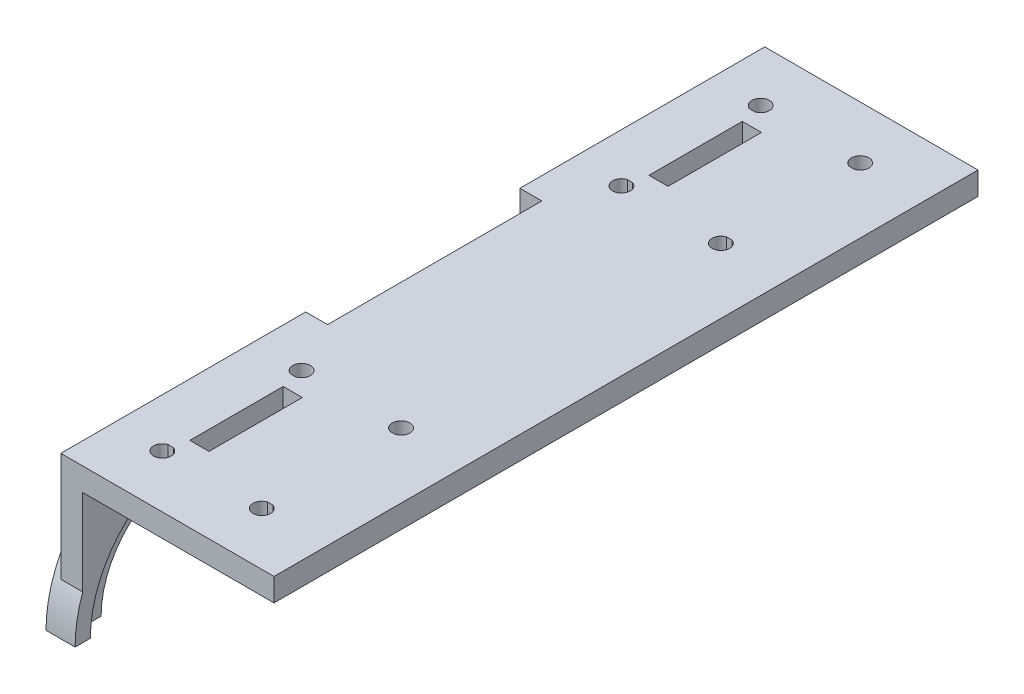
from build123d import *
from build123d.topology import SkipClean

# Parameters (mm, degrees)
SKETCH1_W           = 25
SKETCH1_H           = 46
SKETCH1_W_2         = 2.5
SKETCH1_H_2         = 12.2
BOSS_EXTRUDE1_DEPTH = 3
R_VOLUTION1_START   = -5.80446125
R_VOLUTION1_DEPTH   = 2
R_VOLUTION1_START_2 = -3.80446125
R_VOLUTION1_2_DEPTH = 1.8
BOSS_EXTRUDE3_START = -4.868108072
BOSS_EXTRUDE3_DEPTH = 2.863646822
SKETCH1_11_R        = 3
SKETCH1_11_R_2      = 2
BOSS_EXTRUDE5_DEPTH = 3
CUT_EXTRUDE1_DEPTH  = 46.512082642


# Read off the part's stored shape, not the designer's step: Révolution1, Boss-Extrude3
with BuildPart() as part:
    # Sketch1 → Boss-Extrude1 (new body)
    with BuildSketch(Plane(origin=(0, 0, 0), x_dir=(1, 0, 0), z_dir=(0, 1, 0))):
        with Locations((10.49553875, 12.405576735)):
            Rectangle(SKETCH1_W, SKETCH1_H)
        with Locations((3.34553875, 5.405576735)):
            Rectangle(SKETCH1_W_2, SKETCH1_H_2, mode=Mode.SUBTRACT)
    boss_extrude1 = extrude(amount=BOSS_EXTRUDE1_DEPTH)



with BuildPart() as body_2:
    # Révolution1 outline → Révolution1 (new body)
    with BuildSketch(Plane.YZ.offset(R_VOLUTION1_START)):
        with BuildLine():
            ThreePointArc((-17, 6.394423265), (-5.2, -5.405576735), (-17, -17.205576735))
            Line((-17, -17.205576735), (-17, -22.405576735))
            ThreePointArc((-17, -22.405576735), (0, -5.405576735), (-17, 11.594423265))
            Line((-17, 11.594423265), (-17, 6.394423265))
        make_face()
    r_volution1 = extrude(amount=R_VOLUTION1_DEPTH)


with BuildPart() as part_1:
    add(part.part)

    add(body_2.part)  # R_volution1 2 merges body 2
    # R_volution1 2 outline → R_volution1 2 (add)
    with BuildSketch(Plane.YZ.offset(R_VOLUTION1_START_2)):
        with BuildLine():
            ThreePointArc((-17, 9.594423265), (-2, -5.405576735), (-17, -20.405576735))
            Line((-17, -20.405576735), (-17, -22.405576735))
            ThreePointArc((-17, -22.405576735), (0, -5.405576735), (-17, 11.594423265))
            Line((-17, 11.594423265), (-17, 9.594423265))
        make_face()
    r_volution1_2 = extrude(amount=R_VOLUTION1_2_DEPTH)

    # Boss-Extrude3 outline → Boss-Extrude3 (add)
    with BuildSketch(Plane.YZ.offset(BOSS_EXTRUDE3_START)):
        with BuildLine():
            Line((3, 10.594423265), (-11.255437353, 10.594423265))
            ThreePointArc((-11.255437353, 10.594423265), (0, -5.405576735), (-11.255437353, -21.405576735))
            Line((-11.255437353, -21.405576735), (3, -21.405576735))
            Line((3, -21.405576735), (3, 10.594423265))
        make_face()
    boss_extrude3 = extrude(amount=BOSS_EXTRUDE3_DEPTH)

    # Sketch1<11> → Boss-Extrude5 (add)
    # profile 1 of 14: a face of its own
    with SkipClean():  # the faces are left unmerged after this step: merging them gives an invalid solid
        with BuildSketch(Plane(origin=(0, 0, 0), x_dir=(1, 0, 0), z_dir=(0, 1, 0))):
            with Locations(Location((14.49553875, -3.694423265, 0), (0, 0, 270))):
                Circle(SKETCH1_11_R)
            with Locations(Location((14.49553875, -3.694423265, 0), (0, 0, 270))):
                Circle(SKETCH1_11_R_2, mode=Mode.SUBTRACT)
        # profile 2 of 14: a face of its own
        with BuildSketch(Plane(origin=(0, 0, 0), x_dir=(1, 0, 0), z_dir=(0, 1, 0))):
            with Locations(Location((14.49553875, 14.505576735, 0), (0, 0, 270))):
                Circle(SKETCH1_11_R)
            with Locations(Location((14.49553875, 14.505576735, 0), (0, 0, 270))):
                Circle(SKETCH1_11_R_2, mode=Mode.SUBTRACT)
        # profile 3 of 14: a face of its own
        with BuildSketch(Plane(origin=(0, 0, 0), x_dir=(1, 0, 0), z_dir=(0, 1, 0))):
            with BuildLine():
                ThreePointArc((17.49553875, 14.505576735), (13.935704597, 17.452878166), (11.704481603, 13.405576735))
                Line((11.704481603, 13.405576735), (12.825209441, 13.405576735))
                ThreePointArc((12.825209441, 13.405576735), (13.921369184, 16.421387088), (16.49553875, 14.505576735))
                ThreePointArc((16.49553875, 14.505576735), (16.411349103, 13.931407169), (16.165868059, 13.405576735))
                Line((16.165868059, 13.405576735), (17.286595897, 13.405576735))
                ThreePointArc((17.286595897, 13.405576735), (17.44284018, 13.945742582), (17.49553875, 14.505576735))
            make_face()
        # profile 4 of 14: a face of its own
        with BuildSketch(Plane(origin=(0, 0, 0), x_dir=(1, 0, 0), z_dir=(0, 1, 0))):
            with BuildLine():
                Line((12.825209441, 13.405576735), (11.704481603, 13.405576735))
                ThreePointArc((11.704481603, 13.405576735), (14.49553875, 11.505576735), (17.286595897, 13.405576735))
                Line((17.286595897, 13.405576735), (16.165868059, 13.405576735))
                ThreePointArc((16.165868059, 13.405576735), (14.49553875, 12.505576735), (12.825209441, 13.405576735))
            make_face()
        # profile 5 of 14: a face of its own
        with BuildSketch(Plane(origin=(0, 0, 0), x_dir=(1, 0, 0), z_dir=(0, 1, 0))):
            with BuildLine():
                ThreePointArc((17.286595897, -2.594423265), (14.49553875, -0.694423265), (11.704481603, -2.594423265))
                Line((11.704481603, -2.594423265), (12.825209441, -2.594423265))
                ThreePointArc((12.825209441, -2.594423265), (14.49553875, -1.694423265), (16.165868059, -2.594423265))
                Line((16.165868059, -2.594423265), (17.286595897, -2.594423265))
            make_face()
        # profile 6 of 14: a face of its own
        with BuildSketch(Plane(origin=(0, 0, 0), x_dir=(1, 0, 0), z_dir=(0, 1, 0))):
            with BuildLine():
                Line((12.825209441, -2.594423265), (11.704481603, -2.594423265))
                ThreePointArc((11.704481603, -2.594423265), (13.935704597, -6.641724695), (17.49553875, -3.694423265))
                ThreePointArc((17.49553875, -3.694423265), (17.44284018, -3.134589112), (17.286595897, -2.594423265))
                Line((17.286595897, -2.594423265), (16.165868059, -2.594423265))
                ThreePointArc((16.165868059, -2.594423265), (16.411349103, -3.120253698), (16.49553875, -3.694423265))
                ThreePointArc((16.49553875, -3.694423265), (13.921369184, -5.610233618), (12.825209441, -2.594423265))
            make_face()
        # profile 7 of 14: a face of its own
        with BuildSketch(Plane(origin=(0, 0, 0), x_dir=(1, 0, 0), z_dir=(0, 1, 0))):
            with BuildLine():
                ThreePointArc((4.286595897, -2.594423265), (1.49553875, -0.694423265), (-1.295518397, -2.594423265))
                Line((-1.295518397, -2.594423265), (-0.174790559, -2.594423265))
                ThreePointArc((-0.174790559, -2.594423265), (1.49553875, -1.694423265), (3.165868059, -2.594423265))
                Line((3.165868059, -2.594423265), (4.286595897, -2.594423265))
            make_face()
        # profile 8 of 14: a face of its own
        with BuildSketch(Plane(origin=(0, 0, 0), x_dir=(1, 0, 0), z_dir=(0, 1, 0))):
            with BuildLine():
                Line((-0.174790559, -2.594423265), (-1.295518397, -2.594423265))
                ThreePointArc((-1.295518397, -2.594423265), (0.935704597, -6.641724695), (4.49553875, -3.694423265))
                ThreePointArc((4.49553875, -3.694423265), (4.44284018, -3.134589112), (4.286595897, -2.594423265))
                Line((4.286595897, -2.594423265), (3.165868059, -2.594423265))
                ThreePointArc((3.165868059, -2.594423265), (3.411349103, -3.120253698), (3.49553875, -3.694423265))
                ThreePointArc((3.49553875, -3.694423265), (0.921369184, -5.610233618), (-0.174790559, -2.594423265))
            make_face()
        # profile 9 of 14: a face of its own
        with BuildSketch(Plane(origin=(0, 0, 0), x_dir=(1, 0, 0), z_dir=(0, 1, 0))):
            with BuildLine():
                ThreePointArc((4.286595897, -2.594423265), (1.49553875, -0.694423265), (-1.295518397, -2.594423265))
                Line((-1.295518397, -2.594423265), (-0.174790559, -2.594423265))
                ThreePointArc((-0.174790559, -2.594423265), (1.49553875, -1.694423265), (3.165868059, -2.594423265))
                Line((3.165868059, -2.594423265), (4.286595897, -2.594423265))
            make_face()
        # profile 10 of 14: a face of its own
        with BuildSketch(Plane(origin=(0, 0, 0), x_dir=(1, 0, 0), z_dir=(0, 1, 0))):
            with BuildLine():
                Line((-0.174790559, -2.594423265), (-1.295518397, -2.594423265))
                ThreePointArc((-1.295518397, -2.594423265), (0.935704597, -6.641724695), (4.49553875, -3.694423265))
                ThreePointArc((4.49553875, -3.694423265), (4.44284018, -3.134589112), (4.286595897, -2.594423265))
                Line((4.286595897, -2.594423265), (3.165868059, -2.594423265))
                ThreePointArc((3.165868059, -2.594423265), (3.411349103, -3.120253698), (3.49553875, -3.694423265))
                ThreePointArc((3.49553875, -3.694423265), (0.921369184, -5.610233618), (-0.174790559, -2.594423265))
            make_face()
        # profile 11 of 14: a face of its own
        with BuildSketch(Plane(origin=(0, 0, 0), x_dir=(1, 0, 0), z_dir=(0, 1, 0))):
            with BuildLine():
                ThreePointArc((4.49553875, 14.505576735), (0.935704597, 17.452878166), (-1.295518397, 13.405576735))
                Line((-1.295518397, 13.405576735), (-0.174790559, 13.405576735))
                ThreePointArc((-0.174790559, 13.405576735), (0.921369184, 16.421387088), (3.49553875, 14.505576735))
                ThreePointArc((3.49553875, 14.505576735), (3.411349103, 13.931407169), (3.165868059, 13.405576735))
                Line((3.165868059, 13.405576735), (4.286595897, 13.405576735))
                ThreePointArc((4.286595897, 13.405576735), (4.44284018, 13.945742582), (4.49553875, 14.505576735))
            make_face()
        # profile 12 of 14: a face of its own
        with BuildSketch(Plane(origin=(0, 0, 0), x_dir=(1, 0, 0), z_dir=(0, 1, 0))):
            with BuildLine():
                Line((-0.174790559, 13.405576735), (-1.295518397, 13.405576735))
                ThreePointArc((-1.295518397, 13.405576735), (1.49553875, 11.505576735), (4.286595897, 13.405576735))
                Line((4.286595897, 13.405576735), (3.165868059, 13.405576735))
                ThreePointArc((3.165868059, 13.405576735), (1.49553875, 12.505576735), (-0.174790559, 13.405576735))
            make_face()
        # profile 13 of 14: a face of its own
        with BuildSketch(Plane(origin=(0, 0, 0), x_dir=(1, 0, 0), z_dir=(0, 1, 0))):
            with BuildLine():
                ThreePointArc((4.49553875, 14.505576735), (0.935704597, 17.452878166), (-1.295518397, 13.405576735))
                Line((-1.295518397, 13.405576735), (-0.174790559, 13.405576735))
                ThreePointArc((-0.174790559, 13.405576735), (0.921369184, 16.421387088), (3.49553875, 14.505576735))
                ThreePointArc((3.49553875, 14.505576735), (3.411349103, 13.931407169), (3.165868059, 13.405576735))
                Line((3.165868059, 13.405576735), (4.286595897, 13.405576735))
                ThreePointArc((4.286595897, 13.405576735), (4.44284018, 13.945742582), (4.49553875, 14.505576735))
            make_face()
        # profile 14 of 14: a face of its own
        with BuildSketch(Plane(origin=(0, 0, 0), x_dir=(1, 0, 0), z_dir=(0, 1, 0))):
            with BuildLine():
                Line((-0.174790559, 13.405576735), (-1.295518397, 13.405576735))
                ThreePointArc((-1.295518397, 13.405576735), (1.49553875, 11.505576735), (4.286595897, 13.405576735))
                Line((4.286595897, 13.405576735), (3.165868059, 13.405576735))
                ThreePointArc((3.165868059, 13.405576735), (1.49553875, 12.505576735), (-0.174790559, 13.405576735))
            make_face()
        boss_extrude5 = extrude(amount=-BOSS_EXTRUDE5_DEPTH)

    # Sketch1<12> → Cut-Extrude1 (cut, through all)
    with SkipClean():  # the faces are left unmerged after this step: merging them gives an invalid solid
        with BuildSketch(Plane(origin=(0, 0, 0), x_dir=(1, 0, 0), z_dir=(0, 1, 0))):
            with BuildLine():
                ThreePointArc((1.830948947, 13.405576735), (1.49553875, 15.655576735), (1.160128553, 13.405576735))
                Line((1.160128553, 13.405576735), (1.830948947, 13.405576735))
            make_face()
            with BuildLine():
                Line((1.830948947, -2.594423265), (1.160128553, -2.594423265))
                ThreePointArc((1.160128553, -2.594423265), (1.49553875, -4.844423265), (1.830948947, -2.594423265))
            make_face()
            with BuildLine():
                ThreePointArc((14.830948947, 13.405576735), (14.49553875, 15.655576735), (14.160128553, 13.405576735))
                Line((14.160128553, 13.405576735), (14.830948947, 13.405576735))
            make_face()
            with BuildLine():
                Line((14.830948947, -2.594423265), (14.160128553, -2.594423265))
                ThreePointArc((14.160128553, -2.594423265), (14.49553875, -4.844423265), (14.830948947, -2.594423265))
            make_face()
        cut_extrude1 = extrude(amount=CUT_EXTRUDE1_DEPTH, mode=Mode.SUBTRACT)

    # Mirror5: Boss-Extrude1, Révolution1, R_volution1 2, Boss-Extrude3, Boss-Extrude5, Cut-Extrude1 across plane
    with SkipClean():  # the faces are left unmerged after this step: merging them gives an invalid solid
        add(boss_extrude1.mirror(Plane(origin=(0, 3, -35.405576735), x_dir=(1, 0, 0), z_dir=(0, 0, -1))))
        add(r_volution1.mirror(Plane(origin=(0, 3, -35.405576735), x_dir=(1, 0, 0), z_dir=(0, 0, -1))))
        add(r_volution1_2.mirror(Plane(origin=(0, 3, -35.405576735), x_dir=(1, 0, 0), z_dir=(0, 0, -1))))
        add(boss_extrude3.mirror(Plane(origin=(0, 3, -35.405576735), x_dir=(1, 0, 0), z_dir=(0, 0, -1))))
        add(boss_extrude5.mirror(Plane(origin=(0, 3, -35.405576735), x_dir=(1, 0, 0), z_dir=(0, 0, -1))))
        add(cut_extrude1.mirror(Plane(origin=(0, 3, -35.405576735), x_dir=(1, 0, 0), z_dir=(0, 0, -1))), mode=Mode.SUBTRACT)


solid = part_1.part
